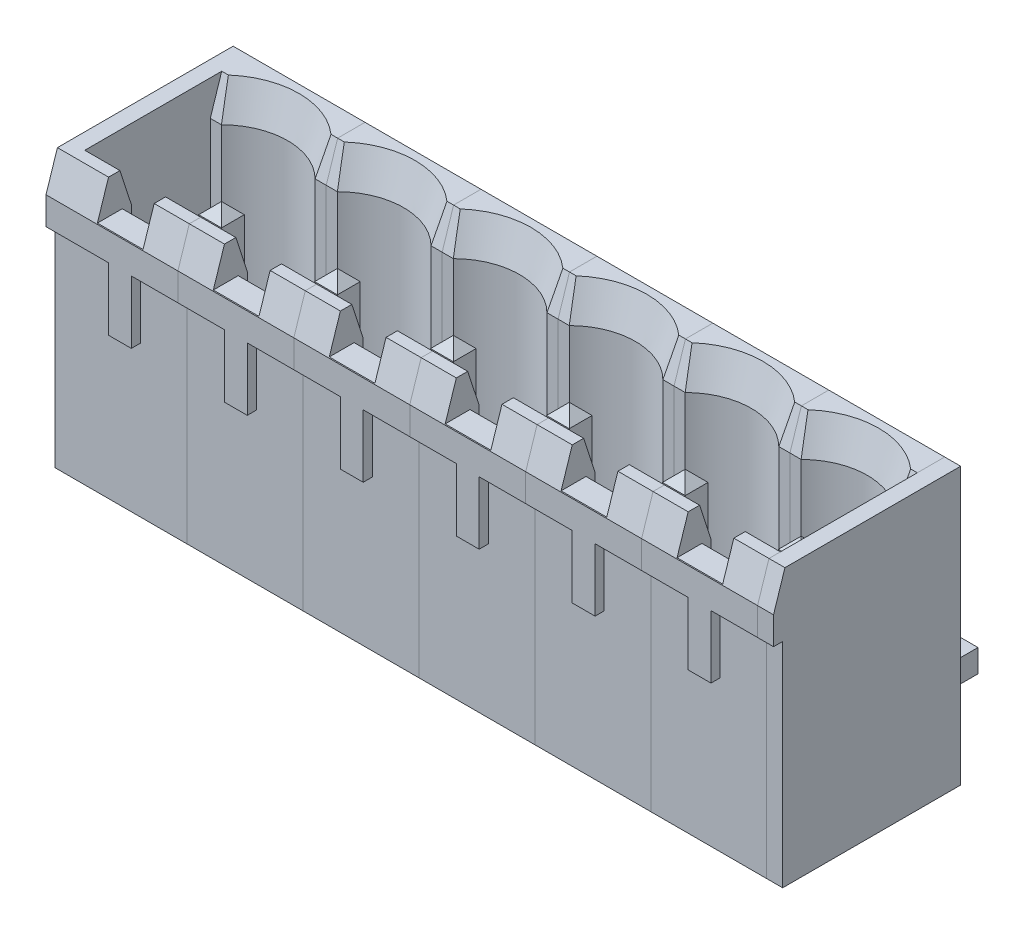
from build123d import *
from OCP.BRepFilletAPI import BRepFilletAPI_MakeChamfer

# Parameters (mm, degrees)
SKETCH_1_W             = 5.08
SKETCH_1_H             = 12.1
EXTRUDE_1_DEPTH        = 8.2
CUT_EXTRUDE_1_DEPTH    = 8.7
SKETCH_3_R             = 1.2
EXTRUDE_2_DEPTH        = 2
FILLET_1_R             = 0.25
CHAMFER_1_SIZE         = 0.5
CHAMFER_1_SIZE2        = 1.538841769
SKETCH_4_W             = 2
SKETCH_4_H             = 1.010953213
CUT_EXTRUDE_2_DEPTH    = 4.75
SKETCH_5_W             = 2
SKETCH_5_H             = 1.705458635
CUT_EXTRUDE_3_DEPTH    = 1.5
CHAMFER_2_SIZE         = 0.5
CHAMFER_2_SIZE2        = 1.538841769
SKETCH_6_W             = 5.08
SKETCH_6_H             = 6.6
CUT_EXTRUDE_4_DEPTH    = 0.4
SKETCH_7_W             = 2.04
SKETCH_7_H             = 2.75
CUT_EXTRUDE_5_DEPTH    = 0.4
EXTRUDE_1_2_DEPTH      = 0.5
EXTRUDE_1_2_DEPTH_BACK = 0.5
CHAMFER_3_SIZE         = 0.5
SKETCH_9_W             = 1
SKETCH_9_H             = 2.1
SKETCH_9_W_2           = 1.04
CUT_EXTRUDE_6_DEPTH    = 6
PATTERN_LINEAR_1_COUNT = 6
PATTERN_LINEAR_1_PITCH = 5.08
EXTRUDE_3_DEPTH        = 0.7
EXTRUDE_4_DEPTH        = 0.7
MOVE_BODY_1_ANGLE      = 180


with BuildPart() as part:
    # Эскиз1 → Extrude 1 (new body)
    with BuildSketch(Plane(origin=(0, 0, 0), x_dir=(1, 0, 0), z_dir=(0, 1, 0))):
        Rectangle(SKETCH_1_W, SKETCH_1_H)
    extrude(amount=EXTRUDE_1_DEPTH)

    # Эскиз2 → Вырез-Вытянуть1 (cut)
    with BuildSketch(Plane.XY.offset(6.05)):
        with BuildLine():
            Line((-2.54, 6.7), (2.54, 6.7))
            Line((2.54, 6.7), (2.54, 1.7))
            Line((2.54, 1.7), (2.05121915, 1.7))
            ThreePointArc((2.05121915, 1.7), (0, 0.85), (-2.05121915, 1.7))
            Line((-2.05121915, 1.7), (-2.54, 1.7))
            Line((-2.54, 1.7), (-2.54, 6.7))
        make_face()
    extrude(amount=-CUT_EXTRUDE_1_DEPTH, mode=Mode.SUBTRACT)

    # Эскиз3 → Бобышка-Вытянуть2 (add)
    with BuildSketch(Plane.XY.offset(-2.65)):
        with Locations((0, 3.75)):
            Circle(SKETCH_3_R)
    extrude(amount=EXTRUDE_2_DEPTH)

    # Скругление1
    fillet_1_edges = [part.edges().sort_by_distance(p)[0] for p in [
        (-1.2, 3.75, -0.65),
    ]]
    fillet(fillet_1_edges, radius=FILLET_1_R)

    # Фаска1: one chamfer whose edges measure the first distance from different faces: ONE call of the kernel's chamfer builder (chamfer() names one face for all edges)
    chamfer_1_edges_1 = [part.edges().sort_by_distance(p)[0] for p in [
        (0, 6.7, 6.05),
    ]]
    chamfer_1_side_1 = [part.faces().sort_by_distance(p)[0] for p in [
        (0, 7.45, 6.05),
    ]]
    chamfer_1_edges_2 = [part.edges().sort_by_distance(p)[0] for p in [
        (2.295609575, 1.7, 6.05),
        (-2.295609575, 1.7, 6.05),
        (0, 0.85, 6.05),
    ]]
    chamfer_1_side_2 = [part.faces().sort_by_distance(p)[0] for p in [
        (0, 0.655214235, 6.05),
    ]]
    chamfer_1 = BRepFilletAPI_MakeChamfer(part.part.solid().wrapped)
    for e in chamfer_1_edges_1:
        chamfer_1.Add(CHAMFER_1_SIZE, CHAMFER_1_SIZE2, e.wrapped, chamfer_1_side_1[0].wrapped)  # the first distance lies on this face
    for e in chamfer_1_edges_2:
        chamfer_1.Add(CHAMFER_1_SIZE, CHAMFER_1_SIZE2, e.wrapped, chamfer_1_side_2[0].wrapped)  # the first distance lies on this face
    add(Compound.cast(chamfer_1.Shape()), mode=Mode.REPLACE)

    # Эскиз4 → Вырез-Вытянуть2 (cut)
    with BuildSketch(Plane.XY.offset(6.05)):
        with Locations((0, 6.594523394)):
            Rectangle(SKETCH_4_W, SKETCH_4_H)
    extrude(amount=-CUT_EXTRUDE_2_DEPTH, mode=Mode.SUBTRACT)

    # Эскиз5 → Вырез-Вытянуть3 (cut)
    with BuildSketch(Plane.XY.offset(6.05)):
        with Locations((0, 7.552729318)):
            Rectangle(SKETCH_5_W, SKETCH_5_H)
    extrude(amount=-CUT_EXTRUDE_3_DEPTH, mode=Mode.SUBTRACT)

    # Фаска2
    chamfer_2_edges = [part.edges().sort_by_distance(p)[0] for p in [
        (-1.77, 8.2, 6.05),
    ]]
    chamfer_2_side = [part.faces().sort_by_distance(p)[0] for p in [
        (-1.77, 7.7, 6.05),
    ]]
    chamfer(chamfer_2_edges, length=CHAMFER_2_SIZE, length2=CHAMFER_2_SIZE2, reference=chamfer_2_side[0])

    # Эскиз6 → Вырез-Вытянуть4 (cut)
    with BuildSketch(Plane(origin=(0, 8.2, 0), x_dir=(1, 0, 0), z_dir=(0, 1, 0))):
        with Locations((0, 2.75)):
            Rectangle(SKETCH_6_W, SKETCH_6_H)
    extrude(amount=-CUT_EXTRUDE_4_DEPTH, mode=Mode.SUBTRACT)

    # Эскиз7 → Вырез-Вытянуть5 (cut)
    with BuildSketch(Plane(origin=(0, 8.2, 0), x_dir=(1, 0, 0), z_dir=(0, 1, 0))):
        with Locations((1.52, -1.925)):
            Rectangle(SKETCH_7_W, SKETCH_7_H)
        with Locations((-1.52, -1.925)):
            Rectangle(SKETCH_7_W, SKETCH_7_H)
    extrude(amount=-CUT_EXTRUDE_5_DEPTH, mode=Mode.SUBTRACT)

    # Эскиз9 → Вырез-Вытянуть6 (cut)
    with BuildSketch(Plane.XZ):
        with Locations((0, -5)):
            Rectangle(SKETCH_9_W, SKETCH_9_H)
        with Locations((-2.02, -5)):
            Rectangle(SKETCH_9_W_2, SKETCH_9_H)
        with Locations((2.02, -5)):
            Rectangle(SKETCH_9_W_2, SKETCH_9_H)
    extrude(amount=-CUT_EXTRUDE_6_DEPTH, mode=Mode.SUBTRACT)


with BuildPart() as body_2:
    # Эскиз8 → Extrude 1 2 (new, two sides: drawn at the far end of the back side and taken through both)
    with BuildSketch(Plane(origin=(0, 0, 0), x_dir=(0, 0, -1), z_dir=(1, 0, 0)).offset(-EXTRUDE_1_2_DEPTH_BACK)):
        with BuildLine():
            Line((-3.65, 3.25), (3.95, 3.25))
            Line((3.95, 3.25), (3.95, -4))
            Line((3.95, -4), (4.95, -4))
            Line((4.95, -4), (4.95, 3.25))
            ThreePointArc((4.95, 3.25), (4.657106781, 3.957106781), (3.95, 4.25))
            Line((3.95, 4.25), (-3.65, 4.25))
            Line((-3.65, 4.25), (-3.65, 3.25))
        make_face()
    extrude(amount=EXTRUDE_1_2_DEPTH + EXTRUDE_1_2_DEPTH_BACK)

    # Фаска3
    chamfer_3_edges = [body_2.edges().sort_by_distance(p)[0] for p in [
        (0, 3.25, 3.65),
        (0, 4.25, 3.65),
        (0, -4, -4.95),
        (0, -4, -3.95),
        (0.5, -4, -4.45),
        (0.5, 3.75, 3.65),
        (-0.5, 3.75, 3.65),
        (-0.5, -4, -4.45),
    ]]
    chamfer(chamfer_3_edges, length=CHAMFER_3_SIZE - 0.0001)  # a hair under: the kernel refuses the full size


with BuildPart() as pattern_linear_1_1:
    # Линейный массив1: pattern copy
    add(part.part.moved(Location(Vector(-1, 0, 0) * (1 * PATTERN_LINEAR_1_PITCH))))


with BuildPart() as pattern_linear_1_2:
    # Линейный массив1: pattern copy
    add(part.part.moved(Location(Vector(-1, 0, 0) * (2 * PATTERN_LINEAR_1_PITCH))))


with BuildPart() as pattern_linear_1_3:
    # Линейный массив1: pattern copy
    add(part.part.moved(Location(Vector(-1, 0, 0) * (3 * PATTERN_LINEAR_1_PITCH))))


with BuildPart() as pattern_linear_1_4:
    # Линейный массив1: pattern copy
    add(part.part.moved(Location(Vector(-1, 0, 0) * (4 * PATTERN_LINEAR_1_PITCH))))


with BuildPart() as pattern_linear_1_5:
    # Линейный массив1: pattern copy
    add(part.part.moved(Location(Vector(-1, 0, 0) * (5 * PATTERN_LINEAR_1_PITCH))))


with BuildPart() as pattern_linear_1_6:
    # Линейный массив1: pattern copy
    add(body_2.part.moved(Location(Vector(-1, 0, 0) * (1 * PATTERN_LINEAR_1_PITCH))))


with BuildPart() as pattern_linear_1_7:
    # Линейный массив1: pattern copy
    add(body_2.part.moved(Location(Vector(-1, 0, 0) * (2 * PATTERN_LINEAR_1_PITCH))))


with BuildPart() as pattern_linear_1_8:
    # Линейный массив1: pattern copy
    add(body_2.part.moved(Location(Vector(-1, 0, 0) * (3 * PATTERN_LINEAR_1_PITCH))))


with BuildPart() as pattern_linear_1_9:
    # Линейный массив1: pattern copy
    add(body_2.part.moved(Location(Vector(-1, 0, 0) * (4 * PATTERN_LINEAR_1_PITCH))))


with BuildPart() as pattern_linear_1_10:
    # Линейный массив1: pattern copy
    add(body_2.part.moved(Location(Vector(-1, 0, 0) * (5 * PATTERN_LINEAR_1_PITCH))))


with BuildPart() as part_1:
    add(part.part)

    # Эскиз10 → Бобышка-Вытянуть3 (add)
    with BuildSketch(Plane(origin=(2.54, 0, 0), x_dir=(0, 0, -1), z_dir=(1, 0, 0))):
        Polygon((6.05, 7.8), (-3.3, 7.8), (-3.3, 8.2), (-4.511158231, 8.2), (-6.05, 7.7), (-6.05, 0), (6.05, 0), align=None)
    extrude(amount=EXTRUDE_3_DEPTH)


with BuildPart() as body_13:
    # Эскиз11 → Бобышка-Вытянуть4 (new body)
    with BuildSketch(Plane.ZY.offset(27.94)):
        Polygon((-6.05, 7.8), (-6.05, 0), (6.05, 0), (6.05, 7.7), (4.511158231, 8.2), (3.3, 8.2), (3.3, 7.8), align=None)
    extrude(amount=EXTRUDE_4_DEPTH)


with BuildPart() as body_2_1:
    # Move Body 1: moved
    add(body_2.part.rotate(Axis((0, 0, 0), (0, 0.7071067811865488, 0.7071067811865462)), MOVE_BODY_1_ANGLE))


with BuildPart() as pattern_linear_1_6_1:
    # Move Body 1: moved
    add(pattern_linear_1_6.part.rotate(Axis((0, 0, 0), (0, 0.7071067811865488, 0.7071067811865462)), MOVE_BODY_1_ANGLE))


with BuildPart() as pattern_linear_1_1_1:
    # Move Body 1: moved
    add(pattern_linear_1_1.part.rotate(Axis((0, 0, 0), (0, 0.7071067811865488, 0.7071067811865462)), MOVE_BODY_1_ANGLE))


with BuildPart() as pattern_linear_1_2_1:
    # Move Body 1: moved
    add(pattern_linear_1_2.part.rotate(Axis((0, 0, 0), (0, 0.7071067811865488, 0.7071067811865462)), MOVE_BODY_1_ANGLE))


with BuildPart() as pattern_linear_1_3_1:
    # Move Body 1: moved
    add(pattern_linear_1_3.part.rotate(Axis((0, 0, 0), (0, 0.7071067811865488, 0.7071067811865462)), MOVE_BODY_1_ANGLE))


with BuildPart() as pattern_linear_1_7_1:
    # Move Body 1: moved
    add(pattern_linear_1_7.part.rotate(Axis((0, 0, 0), (0, 0.7071067811865488, 0.7071067811865462)), MOVE_BODY_1_ANGLE))


with BuildPart() as pattern_linear_1_8_1:
    # Move Body 1: moved
    add(pattern_linear_1_8.part.rotate(Axis((0, 0, 0), (0, 0.7071067811865488, 0.7071067811865462)), MOVE_BODY_1_ANGLE))


with BuildPart() as pattern_linear_1_9_1:
    # Move Body 1: moved
    add(pattern_linear_1_9.part.rotate(Axis((0, 0, 0), (0, 0.7071067811865488, 0.7071067811865462)), MOVE_BODY_1_ANGLE))


with BuildPart() as pattern_linear_1_10_1:
    # Move Body 1: moved
    add(pattern_linear_1_10.part.rotate(Axis((0, 0, 0), (0, 0.7071067811865488, 0.7071067811865462)), MOVE_BODY_1_ANGLE))


with BuildPart() as pattern_linear_1_4_1:
    # Move Body 1: moved
    add(pattern_linear_1_4.part.rotate(Axis((0, 0, 0), (0, 0.7071067811865488, 0.7071067811865462)), MOVE_BODY_1_ANGLE))


with BuildPart() as pattern_linear_1_5_1:
    # Move Body 1: moved
    add(pattern_linear_1_5.part.rotate(Axis((0, 0, 0), (0, 0.7071067811865488, 0.7071067811865462)), MOVE_BODY_1_ANGLE))


with BuildPart() as part_2:
    # Move Body 1: moved
    add(part_1.part.rotate(Axis((0, 0, 0), (0, 0.7071067811865488, 0.7071067811865462)), MOVE_BODY_1_ANGLE))


with BuildPart() as body_13_1:
    # Move Body 1: moved
    add(body_13.part.rotate(Axis((0, 0, 0), (0, 0.7071067811865488, 0.7071067811865462)), MOVE_BODY_1_ANGLE))


with BuildPart() as body_13_2:
    # Move Body 2: read off the stored shape, not the designer's step
    # Move Body 2: moved
    add(body_13_1.part.moved(Location((0, 4.45, 0))))


with BuildPart() as part_3:
    # Move Body 2 2: moved
    add(part_2.part.moved(Location((0, 4.45, 0))))


with BuildPart() as pattern_linear_1_5_2:
    # Move Body 2 3: moved
    add(pattern_linear_1_5_1.part.moved(Location((0, 4.45, 0))))


with BuildPart() as pattern_linear_1_4_2:
    # Move Body 2 4: moved
    add(pattern_linear_1_4_1.part.moved(Location((0, 4.45, 0))))


with BuildPart() as pattern_linear_1_10_2:
    # Move Body 2 5: moved
    add(pattern_linear_1_10_1.part.moved(Location((0, 4.45, 0))))


with BuildPart() as pattern_linear_1_9_2:
    # Move Body 2 6: moved
    add(pattern_linear_1_9_1.part.moved(Location((0, 4.45, 0))))


with BuildPart() as pattern_linear_1_8_2:
    # Move Body 2 7: moved
    add(pattern_linear_1_8_1.part.moved(Location((0, 4.45, 0))))


with BuildPart() as pattern_linear_1_7_2:
    # Move Body 2 8: moved
    add(pattern_linear_1_7_1.part.moved(Location((0, 4.45, 0))))


with BuildPart() as pattern_linear_1_3_2:
    # Move Body 2 9: moved
    add(pattern_linear_1_3_1.part.moved(Location((0, 4.45, 0))))


with BuildPart() as pattern_linear_1_2_2:
    # Move Body 2 10: moved
    add(pattern_linear_1_2_1.part.moved(Location((0, 4.45, 0))))


with BuildPart() as pattern_linear_1_1_2:
    # Move Body 2 11: moved
    add(pattern_linear_1_1_1.part.moved(Location((0, 4.45, 0))))


with BuildPart() as pattern_linear_1_6_2:
    # Move Body 2 12: moved
    add(pattern_linear_1_6_1.part.moved(Location((0, 4.45, 0))))


with BuildPart() as body_2_2:
    # Move Body 2 13: moved
    add(body_2_1.part.moved(Location((0, 4.45, 0))))


solid = Compound([body_13_2.part, part_3.part, pattern_linear_1_5_2.part, pattern_linear_1_4_2.part, pattern_linear_1_10_2.part, pattern_linear_1_9_2.part, pattern_linear_1_8_2.part, pattern_linear_1_7_2.part, pattern_linear_1_3_2.part, pattern_linear_1_2_2.part, pattern_linear_1_1_2.part, pattern_linear_1_6_2.part, body_2_2.part])
